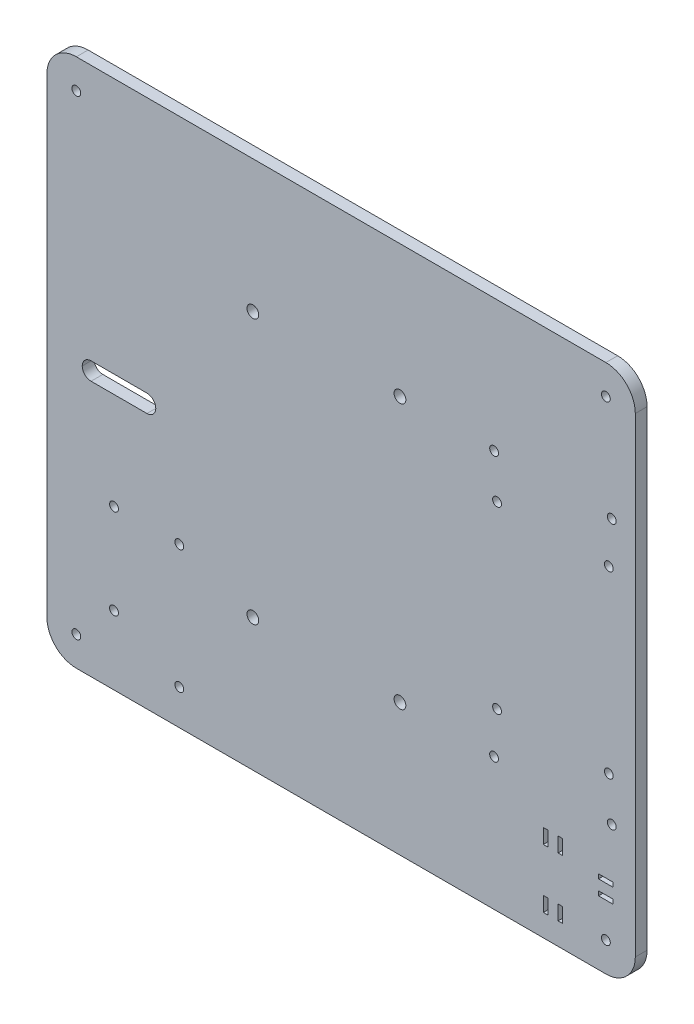
from build123d import *

# Parameters (mm, degrees)
SKETCH1_W           = 200.000000134
SKETCH1_H           = 180
BOSS_EXTRUDE1_DEPTH = 4
SKETCH2_R           = 2
CUT_EXTRUDE1_DEPTH  = 139.351002938
FILLET1_R           = 10
SKETCH4_R           = 1.5
CUT_EXTRUDE3_DEPTH  = 20
SKETCH5_R           = 1.5
CUT_EXTRUDE4_DEPTH  = 139.351002938
SKETCH6_W           = 1.5
SKETCH6_H           = 5
SKETCH6_W_2         = 5
SKETCH6_H_2         = 1.5
CUT_EXTRUDE5_DEPTH  = 139.351002938
SKETCH7_R           = 1.5
CUT_EXTRUDE6_DEPTH  = 139.351002938
SKETCH8_R           = 1.5
CUT_EXTRUDE7_DEPTH  = 139.351002938
SKETCH9_W           = 25
SKETCH9_H           = 6
CUT_EXTRUDE8_DEPTH  = 10
FILLET2_R           = 3


with BuildPart() as part:
    # Sketch1 → Boss-Extrude1 (new body)
    with BuildSketch(Plane.XY):
        with Locations((5, 0)):
            Rectangle(SKETCH1_W, SKETCH1_H)
    extrude(amount=BOSS_EXTRUDE1_DEPTH)

    # Sketch2 → Cut-Extrude1 (cut, through all)
    with BuildSketch(Plane(origin=(0, 0, 0), x_dir=(-1, 0, 0), z_dir=(0, 0, -1))):
        with Locations((25, 45)):
            Circle(SKETCH2_R)
        with Locations((-25, 45)):
            Circle(SKETCH2_R)
        with Locations((-25, -45)):
            Circle(SKETCH2_R)
        with Locations((25, -45)):
            Circle(SKETCH2_R)
    extrude(amount=-CUT_EXTRUDE1_DEPTH, mode=Mode.SUBTRACT)

    # Fillet1
    fillet1_edges = [part.edges().sort_by_distance(p)[0] for p in [
        (-95.000000067, 90, 2),
        (105.000000067, 90, 2),
        (105.000000067, -90, 2),
        (-95.000000067, -90, 2),
    ]]
    fillet(fillet1_edges, radius=FILLET1_R)

    # Sketch4 → Cut-Extrude3 (cut)
    with BuildSketch(Plane(origin=(0, 0, 0), x_dir=(-1, 0, 0), z_dir=(0, 0, -1))):
        with Locations((-96.000000067, 30.5)):
            Circle(SKETCH4_R)
        with Locations((-58.000000067, 30.5)):
            Circle(SKETCH4_R)
        with Locations((-96.000000067, -30.5)):
            Circle(SKETCH4_R)
        with Locations((-58.000000067, -30.5)):
            Circle(SKETCH4_R)
    extrude(amount=-CUT_EXTRUDE3_DEPTH, mode=Mode.SUBTRACT)

    # Sketch5 → Cut-Extrude4 (cut, through all)
    with BuildSketch(Plane(origin=(0, 0, 0), x_dir=(-1, 0, 0), z_dir=(0, 0, -1))):
        with Locations((-57.000000067, 45)):
            Circle(SKETCH5_R)
        with Locations((-97.000000067, 45)):
            Circle(SKETCH5_R)
        with Locations((-97.000000067, -45)):
            Circle(SKETCH5_R)
        with Locations((-57.000000067, -45)):
            Circle(SKETCH5_R)
    extrude(amount=-CUT_EXTRUDE4_DEPTH, mode=Mode.SUBTRACT)

    # Sketch6 → Cut-Extrude5 (cut, through all)
    with BuildSketch(Plane(origin=(0, 0, 0), x_dir=(-1, 0, 0), z_dir=(0, 0, -1))):
        with Locations((-74.500000067, -60)):
            Rectangle(SKETCH6_W, SKETCH6_H)
        with Locations((-79.500000067, -60)):
            Rectangle(SKETCH6_W, SKETCH6_H)
        with Locations((-74.500000067, -80)):
            Rectangle(SKETCH6_W, SKETCH6_H)
        with Locations((-79.500000067, -80)):
            Rectangle(SKETCH6_W, SKETCH6_H)
        with Locations((-95.000000067, -67.5)):
            Rectangle(SKETCH6_W_2, SKETCH6_H_2)
        with Locations((-95.000000067, -62.5)):
            Rectangle(SKETCH6_W_2, SKETCH6_H_2)
    extrude(amount=-CUT_EXTRUDE5_DEPTH, mode=Mode.SUBTRACT)

    # Sketch7 → Cut-Extrude6 (cut, through all)
    with BuildSketch(Plane(origin=(0, 0, 0), x_dir=(-1, 0, 0), z_dir=(0, 0, -1))):
        with Locations((85.000000067, 80)):
            Circle(SKETCH7_R)
        with Locations((85.000000067, -80)):
            Circle(SKETCH7_R)
        with Locations((-95.000000067, -80)):
            Circle(SKETCH7_R)
        with Locations((-95.000000067, 80)):
            Circle(SKETCH7_R)
    extrude(amount=-CUT_EXTRUDE6_DEPTH, mode=Mode.SUBTRACT)

    # Sketch8 → Cut-Extrude7 (cut, through all)
    with BuildSketch(Plane(origin=(0, 0, 0), x_dir=(-1, 0, 0), z_dir=(0, 0, -1))):
        with Locations((50.000000067, -78)):
            Circle(SKETCH8_R)
        with Locations((72.200000067, -66.6)):
            Circle(SKETCH8_R)
        with Locations((72.200000067, -36)):
            Circle(SKETCH8_R)
        with Locations((50.000000067, -36)):
            Circle(SKETCH8_R)
    extrude(amount=-CUT_EXTRUDE7_DEPTH, mode=Mode.SUBTRACT)

    # Sketch9 → Cut-Extrude8 (cut)
    with BuildSketch(Plane.XY.offset(4)):
        with Locations((-70.500000067, 0)):
            Rectangle(SKETCH9_W, SKETCH9_H)
    extrude(amount=-CUT_EXTRUDE8_DEPTH, mode=Mode.SUBTRACT)

    # Fillet2
    fillet2_edges = [part.edges().sort_by_distance(p)[0] for p in [
        (-58.000000067, -3, 2),
        (-58.000000067, 3, 2),
        (-83.000000067, -3, 2),
        (-83.000000067, 3, 2),
    ]]
    fillet(fillet2_edges, radius=FILLET2_R - 0.0001)  # a hair under: the kernel refuses the full size


solid = part.part
